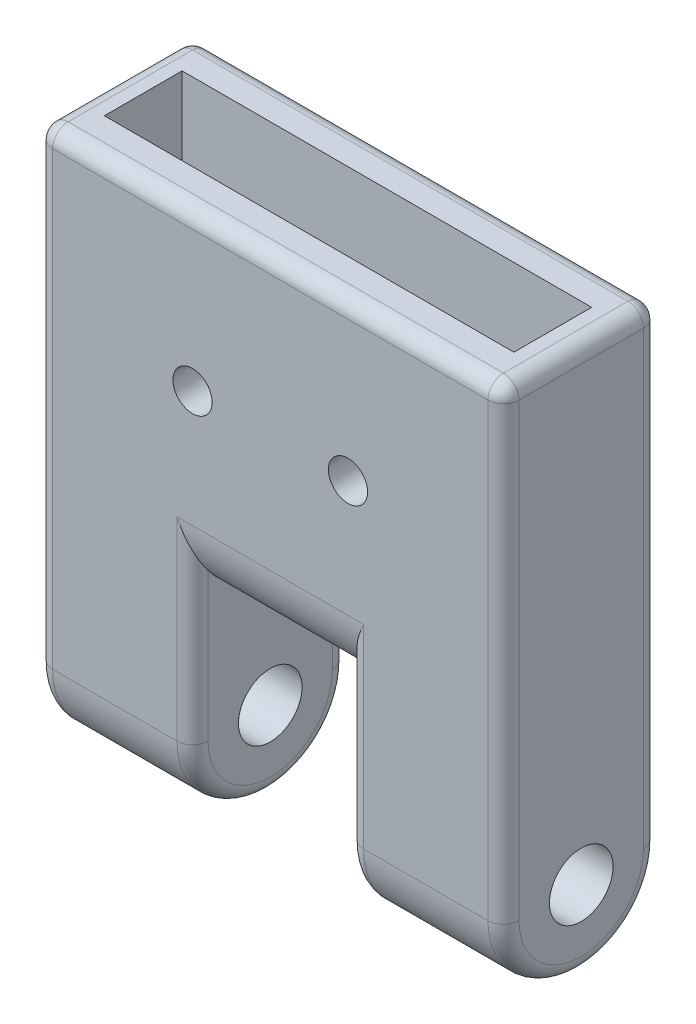
from build123d import *

# Parameters (mm, degrees)
ESQUISSE1_W             = 38.1
ESQUISSE1_H             = 12.7
BOSS_EXTRU_1_DEPTH      = 3.175
ESQUISSE2_W             = 38.1
ESQUISSE2_H             = 12.7
ESQUISSE2_W_2           = 33.4518
ESQUISSE2_H_2           = 6.35
BOSS_EXTRU_2_DEPTH      = 25.4
ESQUISSE3_R             = 1.6
ENL_V_MAT_EXTRU_1_DEPTH = 25.4
ESQUISSE4_R             = 2.6
BOSS_EXTRU_3_DEPTH      = 12.7
CONG_1_R                = 6.35
CONG_2_R                = 1.27


with BuildPart() as part:
    # Esquisse1 → Boss.-Extru.1 (new body)
    with BuildSketch(Plane(origin=(0, 0, 0), x_dir=(1, 0, 0), z_dir=(0, 1, 0))):
        Rectangle(ESQUISSE1_W, ESQUISSE1_H)
    extrude(amount=BOSS_EXTRU_1_DEPTH)

    # Esquisse2 → Boss.-Extru.2 (add)
    with BuildSketch(Plane(origin=(0, 3.175, 0), x_dir=(1, 0, 0), z_dir=(0, 1, 0))):
        Rectangle(ESQUISSE2_W, ESQUISSE2_H)
        Rectangle(ESQUISSE2_W_2, ESQUISSE2_H_2, mode=Mode.SUBTRACT)
    extrude(amount=BOSS_EXTRU_2_DEPTH)

    # Esquisse3 → Enlèv. mat.-Extru.1 (cut)
    with BuildSketch(Plane.XY.offset(6.35)):
        with Locations((-6.35, 15.875)):
            Circle(ESQUISSE3_R)
        with Locations((6.35, 15.875)):
            Circle(ESQUISSE3_R)
    extrude(amount=-ENL_V_MAT_EXTRU_1_DEPTH, mode=Mode.SUBTRACT)

    # Esquisse4 → Boss.-Extru.3 (add)
    with BuildSketch(Plane(origin=(19.05, 0, 0), x_dir=(0, 0, -1), z_dir=(1, 0, 0))):
        with BuildLine():
            Line((-6.35, 0), (-6.35, -9.525))
            ThreePointArc((-6.35, -9.525), (0, -15.875), (6.35, -9.525))
            Line((6.35, -9.525), (6.35, 0))
            Line((6.35, 0), (-6.35, 0))
        make_face()
        with Locations((0, -9.525)):
            Circle(ESQUISSE4_R, mode=Mode.SUBTRACT)
    boss_extru_3 = extrude(amount=-BOSS_EXTRU_3_DEPTH)

    # Symétrie1: Boss.-Extru.3 across plane
    add(boss_extru_3.mirror(Plane(origin=(0, 0, 0), x_dir=(0, 0, 1), z_dir=(1, 0, 0))))

    # Congé1
    cong_1_edges = [part.edges().sort_by_distance(p)[0] for p in [
        (0, 0, -6.35),
        (0, 0, 6.35),
    ]]
    fillet(cong_1_edges, radius=CONG_1_R - 0.0001)  # a hair under: the kernel refuses the full size

    # Congé2
    cong_2_edges = [part.edges().sort_by_distance(p)[0] for p in [
        (-19.05, 28.575, 0),
        (0, 28.575, 6.35),
        (19.05, 28.575, 0),
        (0, 28.575, -6.35),
        (6.35, -1.58755, -6.35),
        (6.35, -15.875, 0),
        (6.35, -1.58755, 6.35),
        (19.05, -15.875, 0),
        (-6.35, -1.58755, 6.35),
        (-6.35, -15.875, 0),
        (-6.35, -1.58755, -6.35),
        (-19.05, -15.875, 0),
        (19.05, 9.525, 6.35),
        (-19.05, 9.525, 6.35),
        (-19.05, 9.525, -6.35),
        (19.05, 9.525, -6.35),
    ]]
    fillet(cong_2_edges, radius=CONG_2_R)


solid = part.part
